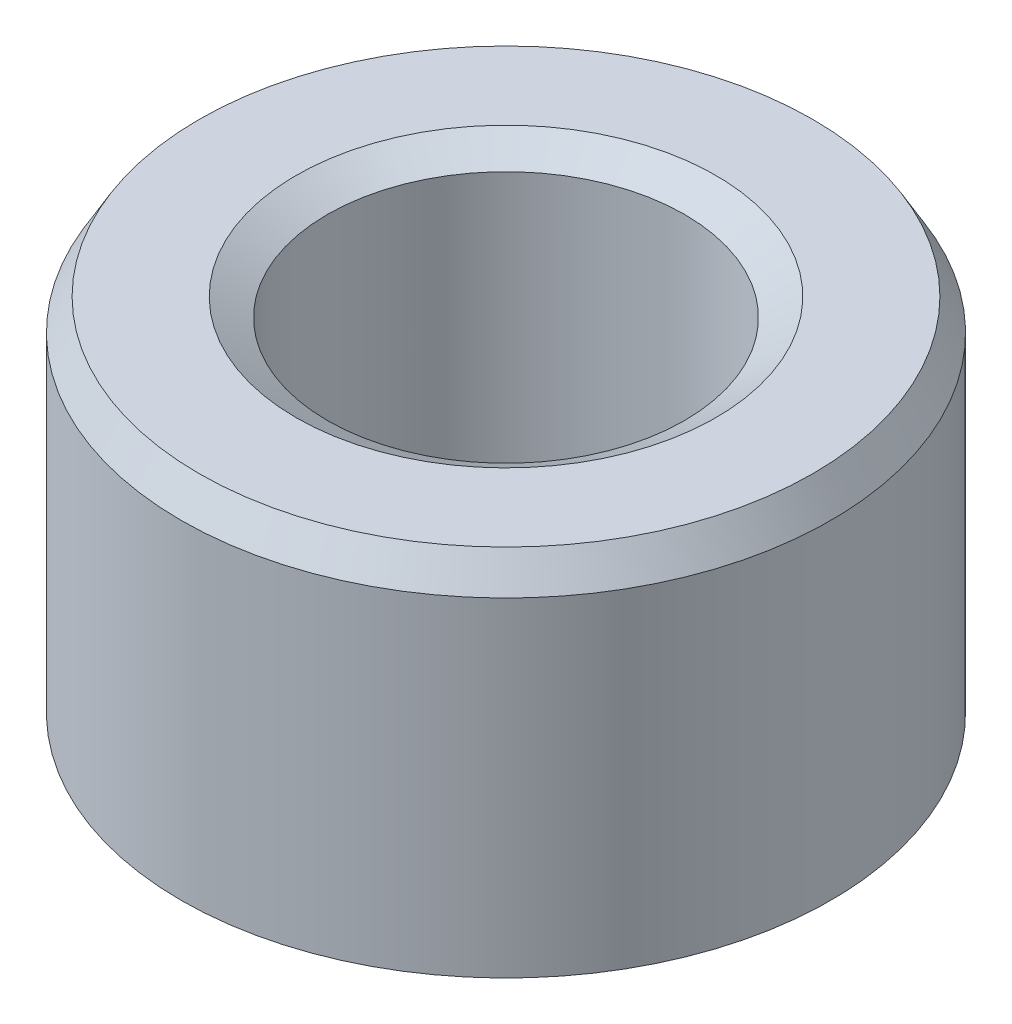
from build123d import *
from OCP.BRepFilletAPI import BRepFilletAPI_MakeChamfer

# Parameters (mm, degrees)
SKETCH1_R           = 32.5
BOSS_EXTRUDE1_DEPTH = 37.856817679
SKETCH2_R           = 17.856191435
CUT_EXTRUDE1_DEPTH  = 60.545265511
CHAMFER1_SIZE       = 3.131958509
CHAMFER1_SIZE2      = 1.814485832


with BuildPart() as part:
    # Sketch1 → Boss-Extrude1 (new body)
    with BuildSketch(Plane(origin=(0, 0, 0), x_dir=(1, 0, 0), z_dir=(0, 1, 0))):
        Circle(SKETCH1_R)
    extrude(amount=BOSS_EXTRUDE1_DEPTH)

    # Sketch2 → Cut-Extrude1 (cut, through all)
    with BuildSketch(Plane(origin=(0, 0, 0), x_dir=(1, 0, 0), z_dir=(0, 1, 0))):
        Circle(SKETCH2_R)
    extrude(amount=CUT_EXTRUDE1_DEPTH, mode=Mode.SUBTRACT)

    # Chamfer1: one chamfer whose edges measure the first distance from different faces: ONE call of the kernel's chamfer builder (chamfer() names one face for all edges)
    chamfer1_edges_1 = [part.edges().sort_by_distance(p)[0] for p in [
        (-17.856191435, 37.856817679, 0),
    ]]
    chamfer1_side_1 = [part.faces().sort_by_distance(p)[0] for p in [
        (-31.580761184, 37.856817679, 0),
    ]]
    chamfer1_edges_2 = [part.edges().sort_by_distance(p)[0] for p in [
        (-17.856191435, 0, 0),
    ]]
    chamfer1_side_2 = [part.faces().sort_by_distance(p)[0] for p in [
        (-17.856191435, 18.92840884, 0),
    ]]
    chamfer1_edges_3 = [part.edges().sort_by_distance(p)[0] for p in [
        (-32.5, 0, 0),
    ]]
    chamfer1_side_3 = [part.faces().sort_by_distance(p)[0] for p in [
        (-31.580761184, 0, 0),
    ]]
    chamfer1_edges_4 = [part.edges().sort_by_distance(p)[0] for p in [
        (-32.5, 37.856817679, 0),
    ]]
    chamfer1_side_4 = [part.faces().sort_by_distance(p)[0] for p in [
        (-32.5, 18.92840884, 0),
    ]]
    chamfer1 = BRepFilletAPI_MakeChamfer(part.part.solid().wrapped)
    for e in chamfer1_edges_1:
        chamfer1.Add(CHAMFER1_SIZE, CHAMFER1_SIZE2, e.wrapped, chamfer1_side_1[0].wrapped)  # the first distance lies on this face
    for e in chamfer1_edges_2:
        chamfer1.Add(CHAMFER1_SIZE, CHAMFER1_SIZE2, e.wrapped, chamfer1_side_2[0].wrapped)  # the first distance lies on this face
    for e in chamfer1_edges_3:
        chamfer1.Add(CHAMFER1_SIZE, CHAMFER1_SIZE2, e.wrapped, chamfer1_side_3[0].wrapped)  # the first distance lies on this face
    for e in chamfer1_edges_4:
        chamfer1.Add(CHAMFER1_SIZE, CHAMFER1_SIZE2, e.wrapped, chamfer1_side_4[0].wrapped)  # the first distance lies on this face
    add(Compound.cast(chamfer1.Shape()), mode=Mode.REPLACE)


solid = part.part
